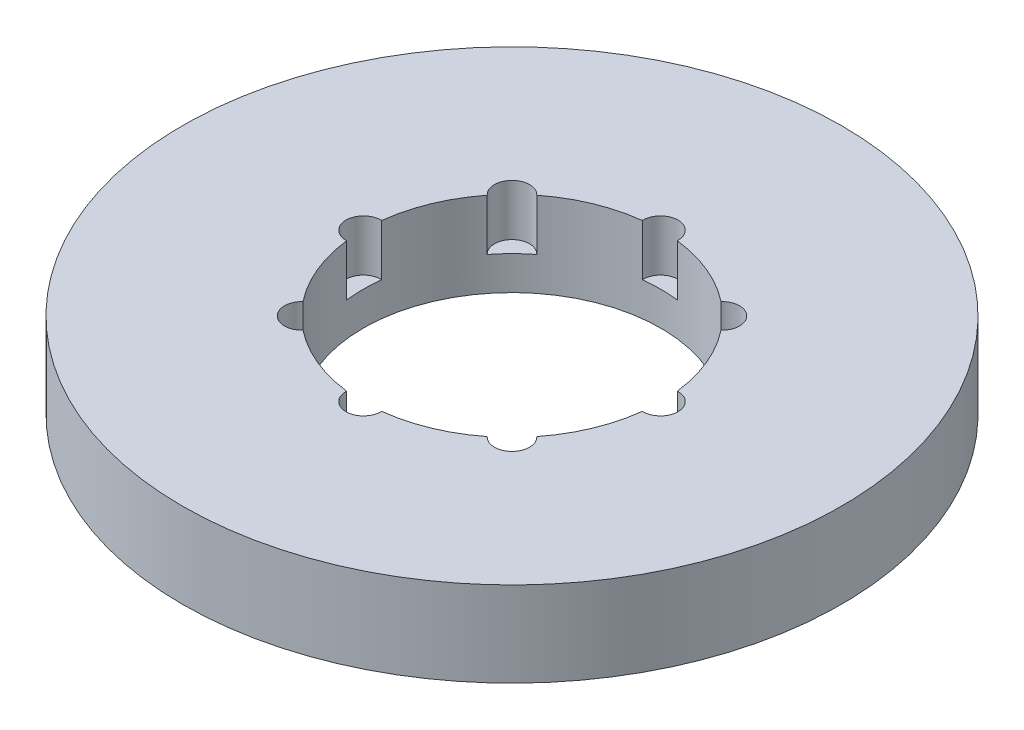
from build123d import *

# Parameters (mm, degrees)
SKETCH1_R           = 77.5
BOSS_EXTRUDE1_DEPTH = 20
SKETCH2_R           = 35
CUT_EXTRUDE1_DEPTH  = 112.411399776
SKETCH3_R           = 4.124622737
CUT_EXTRUDE2_DEPTH  = 12.063490207
CIRPATTERN1_COUNT   = 8


with BuildPart() as part:
    # Sketch1 → Boss-Extrude1 (new body)
    with BuildSketch(Plane(origin=(0, 0, 0), x_dir=(1, 0, 0), z_dir=(0, 1, 0))):
        Circle(SKETCH1_R)
    extrude(amount=BOSS_EXTRUDE1_DEPTH)

    # Sketch2 → Cut-Extrude1 (cut, through all)
    with BuildSketch(Plane(origin=(0, 0, 0), x_dir=(1, 0, 0), z_dir=(0, 1, 0))):
        Circle(SKETCH2_R)
    extrude(amount=CUT_EXTRUDE1_DEPTH, mode=Mode.SUBTRACT)

    # Sketch3 → Cut-Extrude2 (cut)
    with BuildSketch(Plane(origin=(0, 20, 0), x_dir=(1, 0, 0), z_dir=(0, 1, 0))):
        with Locations((-34.911588421, 0)):
            Circle(SKETCH3_R)
    cut_extrude2 = extrude(amount=-CUT_EXTRUDE2_DEPTH, mode=Mode.SUBTRACT)

    # CirPattern1: Cut-Extrude2 ×8 about axis
    cirpattern1_axis = Axis((0, 0, 0), (0, 1, 0))
    for i in range(1, CIRPATTERN1_COUNT):
        add(cut_extrude2.rotate(cirpattern1_axis, i * 360 / CIRPATTERN1_COUNT), mode=Mode.SUBTRACT)


solid = part.part
